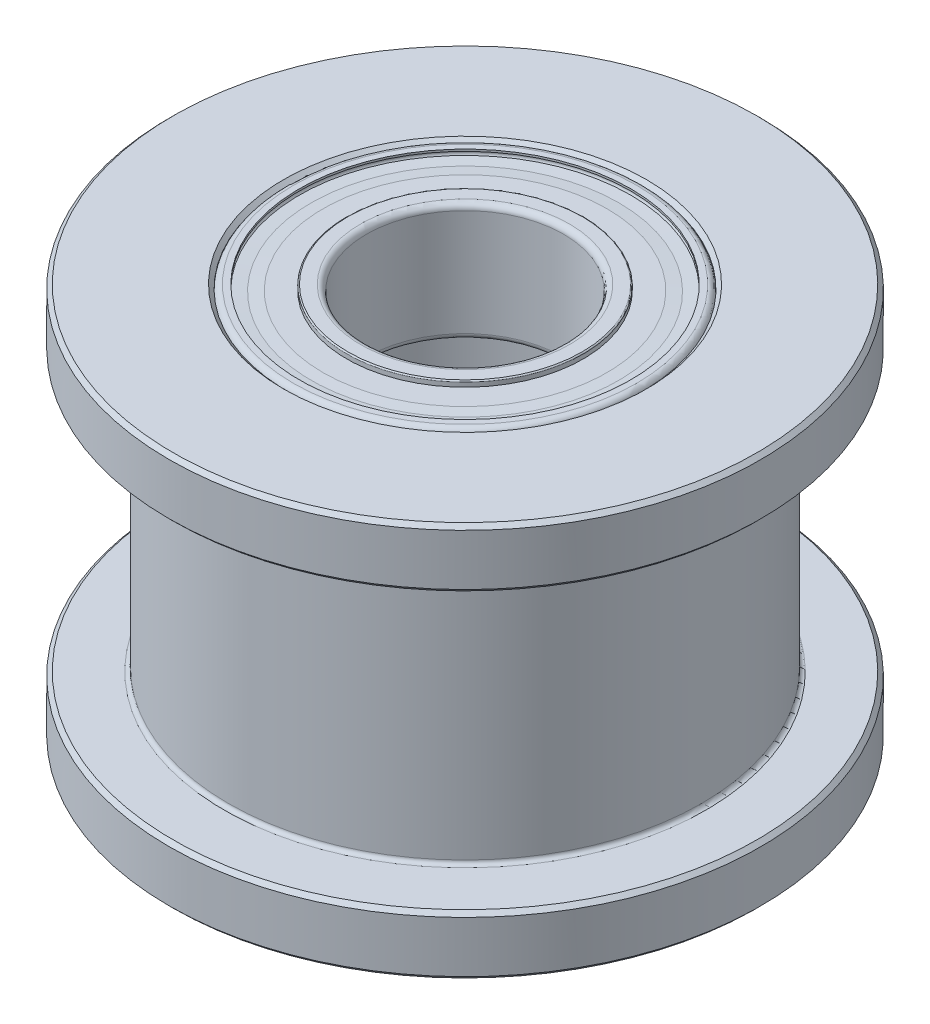
from build123d import *

# Parameters (mm, degrees)
ZKOSEN_1_SIZE      = 0.1
ZAOBLIT1_R         = 0.1
KRUHOV_POLE1_COUNT = 8
KRUHOV_POLE3_COUNT = 8


with BuildPart() as part:
    # Skica1 → Rotovat1 (revolve)
    with BuildSketch(Plane.XY):
        Polygon((4.5, 10), (7.5, 10), (7.5, 8.5), (6, 8.5), (6, 1.5), (7.5, 1.5), (7.5, 0), (4.5, 0), (4.5, 3), (3.5, 3), (3.5, 7), (4.5, 7), align=None)
    revolve(axis=Axis((0, 0, 0), (0, -1, 0)))

    # Zkosení1
    zkosen_1_edges = [part.edges().sort_by_distance(p)[0] for p in [
        (-3.5, 3, 0),
        (-4.5, 0, 0),
        (-3.5, 7, 0),
        (-7.5, 0, 0),
        (-7.5, 1.5, 0),
        (-7.5, 8.5, 0),
        (-7.5, 10, 0),
        (-4.5, 10, 0),
    ]]
    chamfer(zkosen_1_edges, length=ZKOSEN_1_SIZE)

    # Zaoblit1
    zaoblit1_edges = [part.edges().sort_by_distance(p)[0] for p in [
        (-4.5, 3, 0),
        (-6, 1.5, 0),
        (-6, 8.5, 0),
        (-4.5, 7, 0),
    ]]
    fillet(zaoblit1_edges, radius=ZAOBLIT1_R)


with BuildPart() as body_2:
    # Skica4 → Rotovat2 (revolve)
    with BuildSketch(Plane.XY):
        with BuildLine():
            Line((4.5, 9.85), (4.5, 7.15))
            ThreePointArc((4.5, 7.15), (4.456066017, 7.043933983), (4.35, 7))
            Line((4.35, 7), (4.2, 7))
            Line((4.2, 7), (4.2, 7.05))
            ThreePointArc((4.2, 7.05), (4.289757174, 7.133393211), (4.213177928, 7.229030007))
            Line((4.213177928, 7.229030007), (3.85, 7.282786405))
            Line((3.85, 7.282786405), (3.85, 8.052786405))
            ThreePointArc((3.85, 8.052786405), (4.05, 8.5), (3.85, 8.947213595))
            Line((3.85, 8.947213595), (3.85, 9.717213595))
            Line((3.85, 9.717213595), (4.213177928, 9.770969993))
            ThreePointArc((4.213177928, 9.770969993), (4.289757174, 9.866606789), (4.2, 9.95))
            Line((4.2, 9.95), (4.2, 10))
            Line((4.2, 10), (4.35, 10))
            ThreePointArc((4.35, 10), (4.456066017, 9.956066017), (4.5, 9.85))
        make_face()
    revolve(axis=Axis((0, 0, 0), (0, 1, 0)))


with BuildPart() as body_3:
    # Skica5 → Rotovat3 (revolve)
    with BuildSketch(Plane.XY):
        with BuildLine():
            Line((2.5, 9.85), (2.5, 7.15))
            ThreePointArc((2.5, 7.15), (2.543933983, 7.043933983), (2.65, 7))
            Line((2.65, 7), (2.97, 7))
            ThreePointArc((2.97, 7), (2.991213203, 7.008786797), (3, 7.03))
            Line((3, 7.03), (3, 7.14))
            Line((3, 7.14), (3.6, 7.14))
            Line((3.6, 7.14), (3.896185034, 7.191714847))
            Line((3.896185034, 7.191714847), (4.192370069, 7.14))
            Line((4.192370069, 7.14), (4.192370069, 7.19))
            Line((4.192370069, 7.19), (3.897467562, 7.258062558))
            Line((3.897467562, 7.258062558), (3.597467562, 7.258062558))
            Line((3.597467562, 7.258062558), (3, 7.19))
            Line((3, 7.19), (3, 8.103137303))
            ThreePointArc((3, 8.103137303), (2.85, 8.5), (3, 8.896862697))
            Line((3, 8.896862697), (3, 9.81))
            Line((3, 9.81), (3.6, 9.77))
            Line((3.6, 9.77), (3.9, 9.77))
            Line((3.9, 9.77), (4.2, 9.81))
            Line((4.2, 9.81), (4.2, 9.86))
            Line((4.2, 9.86), (3.9, 9.84))
            Line((3.9, 9.84), (3.6, 9.86))
            Line((3.6, 9.86), (3, 9.86))
            Line((3, 9.86), (3, 9.97))
            ThreePointArc((3, 9.97), (2.991213203, 9.991213203), (2.97, 10))
            Line((2.97, 10), (2.65, 10))
            ThreePointArc((2.65, 10), (2.543933983, 9.956066017), (2.5, 9.85))
        make_face()
    revolve(axis=Axis((0, 0, 0), (0, 1, 0)))


with BuildPart() as body_4:
    # Skica6 → Rotovat4 (revolve)
    with BuildSketch(Plane.XY):
        with BuildLine():
            Line((3.45, 9.1), (3.45, 7.9))
            ThreePointArc((3.45, 7.9), (4.05, 8.5), (3.45, 9.1))
        make_face()
    revolve(axis=Axis((3.45, 9.1, 0), (0, -1, 0)))


with BuildPart() as kruhov_pole1_1:
    # Kruhové pole1: pattern copy
    add(body_4.part.rotate(Axis((0, 0, 0), (0, 1, 0)), 1 * 360 / KRUHOV_POLE1_COUNT))


with BuildPart() as kruhov_pole1_2:
    # Kruhové pole1: pattern copy
    add(body_4.part.rotate(Axis((0, 0, 0), (0, 1, 0)), 2 * 360 / KRUHOV_POLE1_COUNT))


with BuildPart() as kruhov_pole1_3:
    # Kruhové pole1: pattern copy
    add(body_4.part.rotate(Axis((0, 0, 0), (0, 1, 0)), 3 * 360 / KRUHOV_POLE1_COUNT))


with BuildPart() as kruhov_pole1_4:
    # Kruhové pole1: pattern copy
    add(body_4.part.rotate(Axis((0, 0, 0), (0, 1, 0)), 4 * 360 / KRUHOV_POLE1_COUNT))


with BuildPart() as kruhov_pole1_5:
    # Kruhové pole1: pattern copy
    add(body_4.part.rotate(Axis((0, 0, 0), (0, 1, 0)), 5 * 360 / KRUHOV_POLE1_COUNT))


with BuildPart() as kruhov_pole1_6:
    # Kruhové pole1: pattern copy
    add(body_4.part.rotate(Axis((0, 0, 0), (0, 1, 0)), 6 * 360 / KRUHOV_POLE1_COUNT))


with BuildPart() as kruhov_pole1_7:
    # Kruhové pole1: pattern copy
    add(body_4.part.rotate(Axis((0, 0, 0), (0, 1, 0)), 7 * 360 / KRUHOV_POLE1_COUNT))


with BuildPart() as body_12:
    # Skica7 → Rotovat5 (revolve)
    with BuildSketch(Plane.XY):
        with BuildLine():
            Line((4.5, 2.85), (4.5, 0.15))
            ThreePointArc((4.5, 0.15), (4.456066017, 0.043933983), (4.35, 0))
            Line((4.35, 0), (4.2, 0))
            Line((4.2, 0), (4.2, 0.05))
            ThreePointArc((4.2, 0.05), (4.289757174, 0.133393211), (4.213177928, 0.229030007))
            Line((4.213177928, 0.229030007), (3.85, 0.282786405))
            Line((3.85, 0.282786405), (3.85, 1.052786405))
            ThreePointArc((3.85, 1.052786405), (4.05, 1.5), (3.85, 1.947213595))
            Line((3.85, 1.947213595), (3.85, 2.717213595))
            Line((3.85, 2.717213595), (4.213177928, 2.770969993))
            ThreePointArc((4.213177928, 2.770969993), (4.289757174, 2.866606789), (4.2, 2.95))
            Line((4.2, 2.95), (4.2, 3))
            Line((4.2, 3), (4.35, 3))
            ThreePointArc((4.35, 3), (4.456066017, 2.956066017), (4.5, 2.85))
        make_face()
    revolve(axis=Axis((0, 0, 0), (0, 1, 0)))


with BuildPart() as body_13:
    # Skica8 → Rotovat6 (revolve)
    with BuildSketch(Plane.XY):
        with BuildLine():
            Line((2.5, 2.85), (2.5, 0.15))
            ThreePointArc((2.5, 0.15), (2.543933983, 0.043933983), (2.65, 0))
            Line((2.65, 0), (2.97, 0))
            ThreePointArc((2.97, 0), (2.991213203, 0.008786797), (3, 0.03))
            Line((3, 0.03), (3, 0.14))
            Line((3, 0.14), (3.6, 0.14))
            Line((3.6, 0.14), (3.896185034, 0.191714847))
            Line((3.896185034, 0.191714847), (4.192370069, 0.14))
            Line((4.192370069, 0.14), (4.192370069, 0.19))
            Line((4.192370069, 0.19), (3.897467562, 0.258062558))
            Line((3.897467562, 0.258062558), (3.597467562, 0.258062558))
            Line((3.597467562, 0.258062558), (3, 0.19))
            Line((3, 0.19), (3, 1.103137303))
            ThreePointArc((3, 1.103137303), (2.85, 1.5), (3, 1.896862697))
            Line((3, 1.896862697), (3, 2.81))
            Line((3, 2.81), (3.6, 2.77))
            Line((3.6, 2.77), (3.9, 2.77))
            Line((3.9, 2.77), (4.2, 2.81))
            Line((4.2, 2.81), (4.2, 2.86))
            Line((4.2, 2.86), (3.9, 2.84))
            Line((3.9, 2.84), (3.6, 2.86))
            Line((3.6, 2.86), (3, 2.86))
            Line((3, 2.86), (3, 2.97))
            ThreePointArc((3, 2.97), (2.991213203, 2.991213203), (2.97, 3))
            Line((2.97, 3), (2.65, 3))
            ThreePointArc((2.65, 3), (2.543933983, 2.956066017), (2.5, 2.85))
        make_face()
    revolve(axis=Axis((0, 0, 0), (0, -1, 0)))


with BuildPart() as body_14:
    # Skica9 → Rotovat7 (revolve)
    with BuildSketch(Plane.XY):
        with BuildLine():
            Line((3.45, 2.1), (3.45, 0.9))
            ThreePointArc((3.45, 0.9), (4.05, 1.5), (3.45, 2.1))
        make_face()
    revolve(axis=Axis((3.45, 2.1, 0), (0, -1, 0)))


with BuildPart() as kruhov_pole3_1:
    # Kruhové pole3: pattern copy
    add(body_14.part.rotate(Axis((0, 0, 0), (0, 1, 0)), 1 * 360 / KRUHOV_POLE3_COUNT))


with BuildPart() as kruhov_pole3_2:
    # Kruhové pole3: pattern copy
    add(body_14.part.rotate(Axis((0, 0, 0), (0, 1, 0)), 2 * 360 / KRUHOV_POLE3_COUNT))


with BuildPart() as kruhov_pole3_3:
    # Kruhové pole3: pattern copy
    add(body_14.part.rotate(Axis((0, 0, 0), (0, 1, 0)), 3 * 360 / KRUHOV_POLE3_COUNT))


with BuildPart() as kruhov_pole3_4:
    # Kruhové pole3: pattern copy
    add(body_14.part.rotate(Axis((0, 0, 0), (0, 1, 0)), 4 * 360 / KRUHOV_POLE3_COUNT))


with BuildPart() as kruhov_pole3_5:
    # Kruhové pole3: pattern copy
    add(body_14.part.rotate(Axis((0, 0, 0), (0, 1, 0)), 5 * 360 / KRUHOV_POLE3_COUNT))


with BuildPart() as kruhov_pole3_6:
    # Kruhové pole3: pattern copy
    add(body_14.part.rotate(Axis((0, 0, 0), (0, 1, 0)), 6 * 360 / KRUHOV_POLE3_COUNT))


with BuildPart() as kruhov_pole3_7:
    # Kruhové pole3: pattern copy
    add(body_14.part.rotate(Axis((0, 0, 0), (0, 1, 0)), 7 * 360 / KRUHOV_POLE3_COUNT))


solid = Compound([part.part, body_2.part, body_3.part, body_4.part, kruhov_pole1_1.part, kruhov_pole1_2.part, kruhov_pole1_3.part, kruhov_pole1_4.part, kruhov_pole1_5.part, kruhov_pole1_6.part, kruhov_pole1_7.part, body_12.part, body_13.part, body_14.part, kruhov_pole3_1.part, kruhov_pole3_2.part, kruhov_pole3_3.part, kruhov_pole3_4.part, kruhov_pole3_5.part, kruhov_pole3_6.part, kruhov_pole3_7.part])
